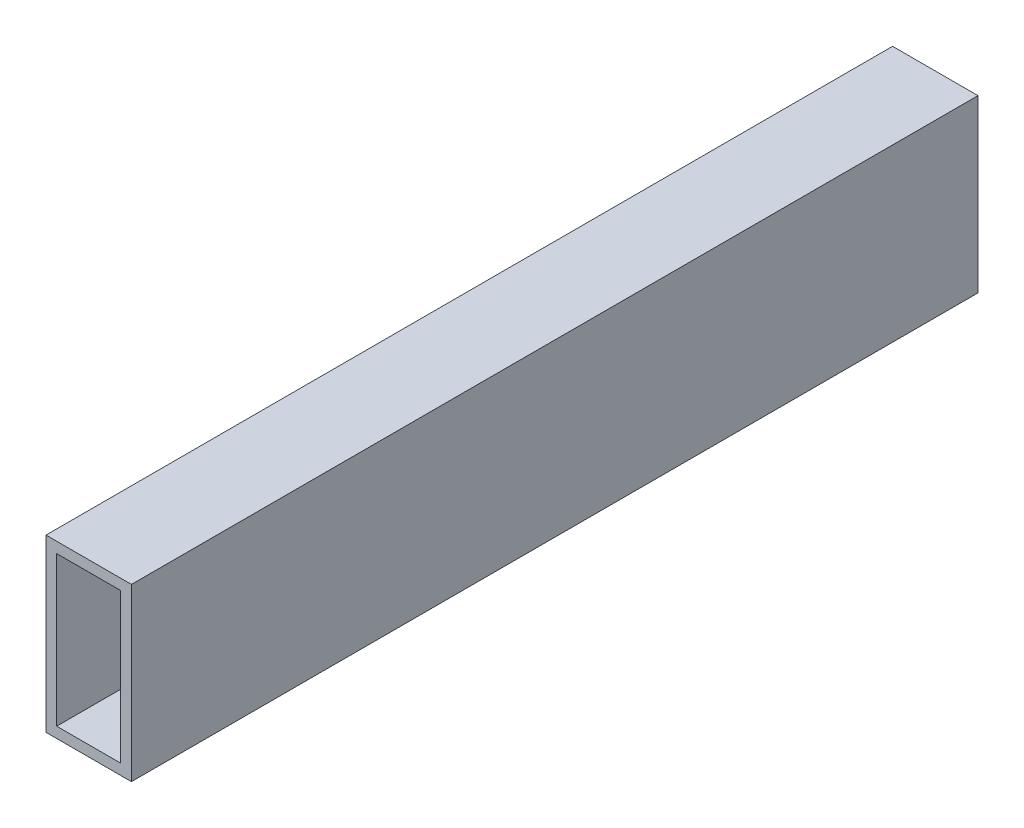
from build123d import *

# Parameters (mm, degrees)
SKETCH1_W           = 25.4
SKETCH1_H           = 50.8
SKETCH1_W_2         = 19.05
SKETCH1_H_2         = 44.45
BOSS_EXTRUDE1_DEPTH = 251.714


with BuildPart() as part:
    # Sketch1 → Boss-Extrude1 (new body)
    with BuildSketch(Plane.XY):
        Rectangle(SKETCH1_W, SKETCH1_H)
        Rectangle(SKETCH1_W_2, SKETCH1_H_2, mode=Mode.SUBTRACT)
    extrude(amount=BOSS_EXTRUDE1_DEPTH)


solid = part.part
